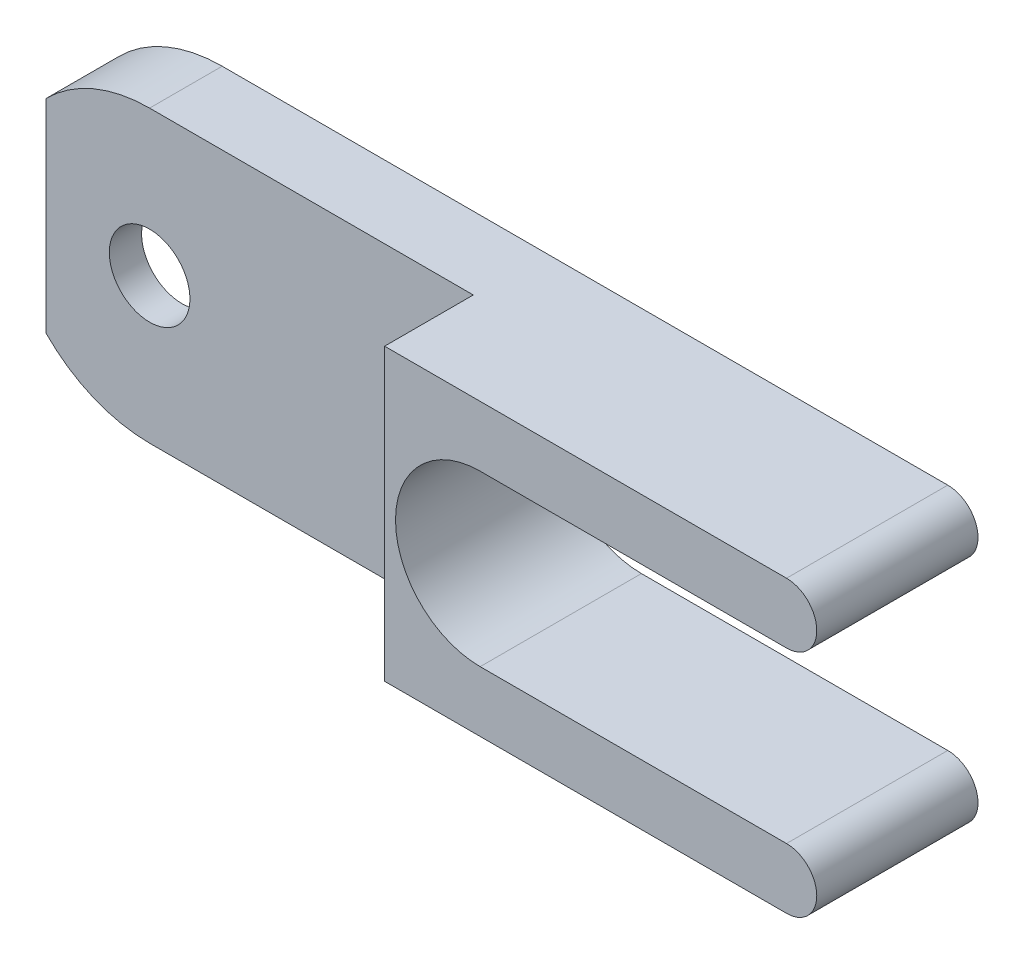
from build123d import *

# Parameters (mm, degrees)
MAIN_DEPTH          = 10
SKETCH1_W           = 26.5
SKETCH1_H           = 18
CUT_EXTRUDE1_DEPTH  = 7.5
ESQUISSE2_R         = 2.5
BOSS_EXTRUDE1_DEPTH = 2


with BuildPart() as part:
    # Esquisse1 → Main (new body)
    with BuildSketch(Plane.XY):
        with BuildLine():
            Line((-4.375785644, 4.25), (-6.426543071, 6.300757427))
            ThreePointArc((-6.426543071, 6.300757427), (-3.48519606, 8.297795395), (0, 9))
            Line((0, 9), (45, 9))
            ThreePointArc((45, 9), (46.875, 7.125), (45, 5.25))
            Line((45, 5.25), (26, 5.25))
            ThreePointArc((26, 5.25), (20.75, 0), (26, -5.25))
            Line((26, -5.25), (45, -5.25))
            ThreePointArc((45, -5.25), (46.875, -7.125), (45, -9))
            Line((45, -9), (0, -9))
            ThreePointArc((0, -9), (-3.48519606, -8.297795395), (-6.426543071, -6.300757427))
            Line((-6.426543071, -6.300757427), (-4.375785644, -4.25))
            ThreePointArc((-4.375785644, -4.25), (0, -6.1), (4.375785644, -4.25))
            Line((4.375785644, -4.25), (17.31559729, -2.78215714))
            ThreePointArc((17.31559729, -2.78215714), (19.8, 0), (17.31559729, 2.78215714))
            Line((17.31559729, 2.78215714), (4.375785644, 4.25))
            ThreePointArc((4.375785644, 4.25), (0, 6.1), (-4.375785644, 4.25))
        make_face()
    extrude(amount=MAIN_DEPTH)

    # Sketch1 → Cut-Extrude1 (cut)
    with BuildSketch(Plane.XY.offset(10)):
        with Locations((6.823456929, 0)):
            Rectangle(SKETCH1_W, SKETCH1_H)
    extrude(amount=-CUT_EXTRUDE1_DEPTH, mode=Mode.SUBTRACT)

    # Esquisse2 → Boss-Extrude1 (add)
    with BuildSketch(Plane(origin=(0, 0, 2.5), x_dir=(-1, 0, 0), z_dir=(0, 0, -1))):
        with BuildLine():
            Line((0, -9), (-20.073456929, -9))
            Line((-20.073456929, -9), (-20.073456929, 9))
            Line((-20.073456929, 9), (0, 9))
            ThreePointArc((0, 9), (3.48519606, 8.297795395), (6.426543071, 6.300757427))
            Line((6.426543071, 6.300757427), (6.426543071, -6.300757427))
            ThreePointArc((6.426543071, -6.300757427), (3.48519606, -8.297795395), (0, -9))
        make_face()
        Circle(ESQUISSE2_R, mode=Mode.SUBTRACT)
    extrude(amount=-BOSS_EXTRUDE1_DEPTH)


solid = part.part
